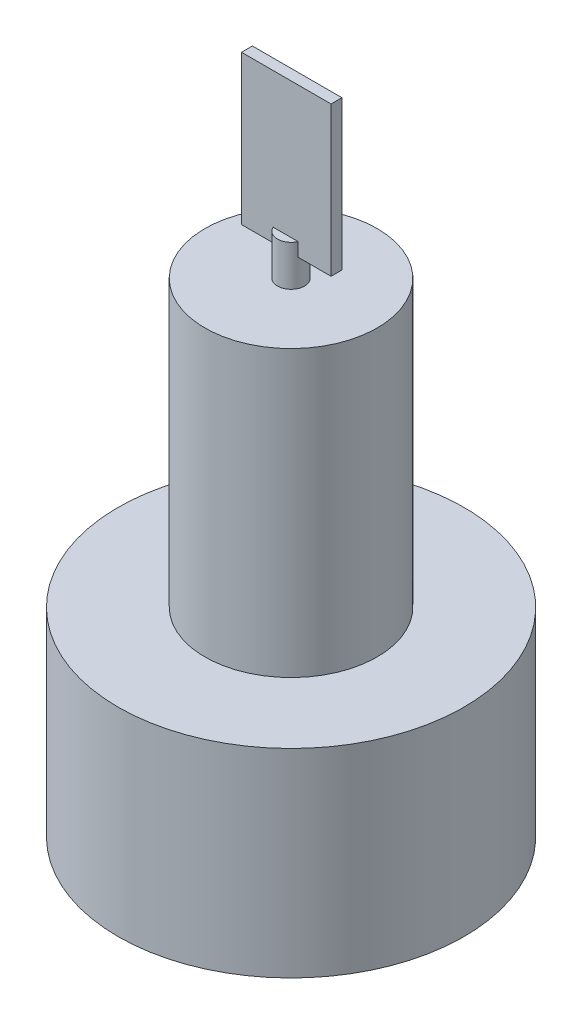
from build123d import *

# Parameters (mm, degrees)
SKETCH_1_R           = 12.75
EXTRUDE_1_DEPTH      = 14.65
SKETCH_2_R           = 6.35
EXTRUDE_2_DEPTH      = 21
SKETCH_3_R           = 1
EXTRUDE_3_DEPTH      = 3
EXTRUDE_4_DEPTH      = 0.4
EXTRUDE_4_DEPTH_BACK = 0.4
SKETCH_4_W           = 6.6
SKETCH_4_H           = 11


with BuildPart() as part:
    # 草图1 → 凸台-拉伸1 (new body)
    with BuildSketch(Plane(origin=(0, 0, 0), x_dir=(1, 0, 0), z_dir=(0, 1, 0))):
        Circle(SKETCH_1_R)
    extrude(amount=EXTRUDE_1_DEPTH)

    # 草图2 → 凸台-拉伸2 (add)
    with BuildSketch(Plane(origin=(0, 14.65, 0), x_dir=(1, 0, 0), z_dir=(0, 1, 0))):
        Circle(SKETCH_2_R)
    extrude(amount=EXTRUDE_2_DEPTH)

    # 草图3 → 凸台-拉伸3 (add)
    with BuildSketch(Plane(origin=(0, 35.65, 0), x_dir=(1, 0, 0), z_dir=(0, 1, 0))):
        Circle(SKETCH_3_R)
    extrude(amount=EXTRUDE_3_DEPTH)

    # 草图4 → 凸台-拉伸4 (add, two sides: drawn at the far end of the back side and taken through both)
    with BuildSketch(Plane.XY.offset(-EXTRUDE_4_DEPTH_BACK)):
        with Locations((0.05, 43.15)):
            Rectangle(SKETCH_4_W, SKETCH_4_H)
    extrude(amount=EXTRUDE_4_DEPTH + EXTRUDE_4_DEPTH_BACK)


solid = part.part
